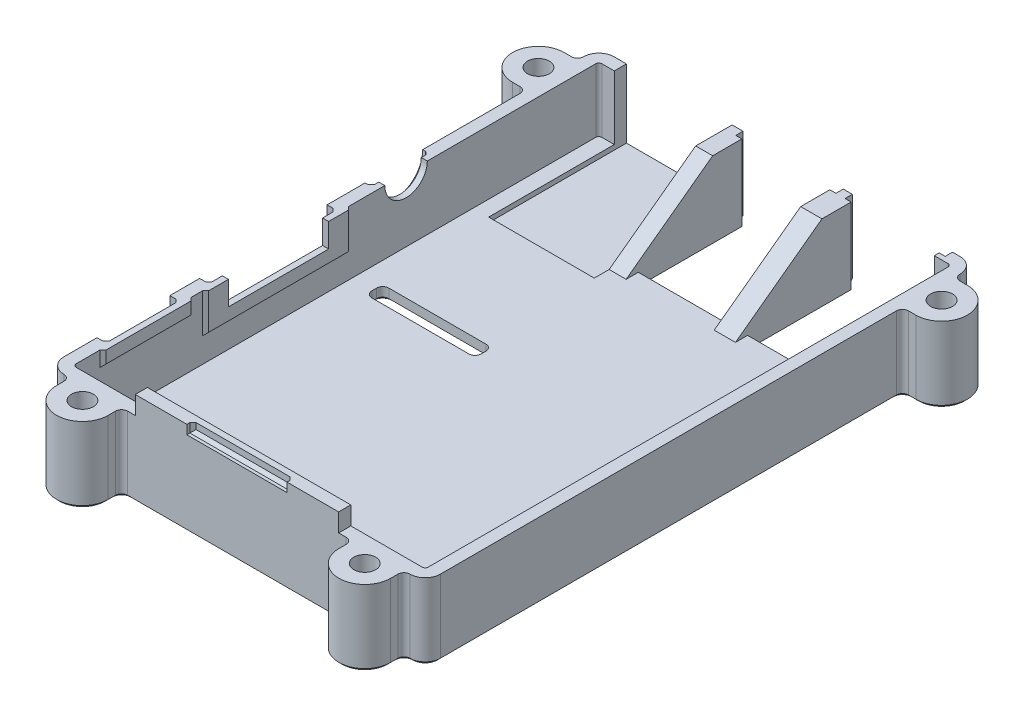
from build123d import *

# Parameters (mm, degrees)
BASE_DEPTH                      = 12.5
SHELL_T                         = -2
CLAMPS_DEPTH                    = 12.5
CLAMP_FILLETS_R                 = 1
SKETCH20_R                      = 1.8
CLAMP_HOLES_DEPTH               = 115.236651299
SKETCH21_R                      = 2.9
CLAMP_COUNTERSINKS_DEPTH        = 3.4
CLAMP_COUNTERSINK_CHAMFERS_SIZE = 0.3
SKETCH22_W                      = 33.5
SKETCH22_H                      = 2
SD_FILL_DEPTH                   = 3
SKETCH23_W                      = 16.5
SKETCH23_H                      = 1.5
SD_APPROACH_DEPTH               = 1
SD_APPROACH_CHAMFER_SIZE        = 0.5
SKETCH24_W                      = 14.5
SKETCH24_H                      = 12.5
USB_CUTOUT_DEPTH                = 18.25
SKETCH25_W                      = 16.5
SKETCH25_H                      = 12.5
USB_APPROACH_DEPTH              = 1.2
USB_INNER_SUPPORT_DEPTH         = 3.5
USB_OUTER_SUPPORT_DEPTH         = 2.8
SKETCH28_W                      = 17.4
SKETCH28_H                      = 11.3
RJ45_CUTOUT_DEPTH               = 22.7
SKETCH29_W                      = 15
SKETCH29_H                      = 2.5
SKETCH29_W_2                    = 24
SKETCH29_H_2                    = 6.43
HDMI_SUPPORT_DEPTH              = 0.5
HDMI_SUPPORT_CHAMFER_SIZE       = 0.5
SKETCH30_W                      = 21
SKETCH30_H                      = 5.93
SKETCH30_W_2                    = 12
SKETCH30_H_2                    = 2
HDMI_APPROACH_DEPTH             = 1.5
SKETCH31_W                      = 16.5
SKETCH31_H                      = 3.93
HDMI_CUTOUT_DEPTH               = 1
HDMI_APPROACH_CHAMFER_SIZE      = 0.5
SKETCH32_R                      = 3.5
AUDIO_CUTOUT_DEPTH              = 2
SKETCH33_R                      = 4.75
AUDIO_APPROACH_DEPTH            = 1
AUDIO_APPROACH_CHAMFER_SIZE     = 0.5
SKETCH34_W                      = 6
SKETCH34_H                      = 52.7
HEADER_CUTOUT_DEPTH             = 2
HEADER_COVER_DEPTH              = 1
RIBBON_SLOTS_DEPTH              = 2
SHELL_CHAMFER_SIZE              = 0.5


with BuildPart() as part:
    # Sketch2 → Base (new body)
    with BuildSketch(Plane(origin=(0, 0, 0), x_dir=(1, 0, 0), z_dir=(0, 1, 0))):
        with BuildLine():
            Line((2.5, 0), (59.5, 0))
            ThreePointArc((59.5, 0), (61.267766953, 0.732233047), (62, 2.5))
            Line((62, 2.5), (62, 88.1))
            ThreePointArc((62, 88.1), (61.267766953, 89.867766953), (59.5, 90.6))
            Line((59.5, 90.6), (2.5, 90.6))
            ThreePointArc((2.5, 90.6), (0.732233047, 89.867766953), (0, 88.1))
            Line((0, 88.1), (0, 2.5))
            ThreePointArc((0, 2.5), (0.732233047, 0.732233047), (2.5, 0))
        make_face()
    extrude(amount=BASE_DEPTH)

    # Shell
    shell_openings = [part.faces().sort_by_distance(p)[0] for p in [
        (31, 12.5, -45.3),
    ]]
    offset(amount=SHELL_T, openings=shell_openings, kind=Kind.INTERSECTION)

    # Sketch14 → Clamps (add)
    with BuildSketch(Plane.XZ):
        with BuildLine():
            Line((-2.2, -78.6), (0, -78.6))
            Line((0, -78.6), (0, -87.1))
            Line((0, -87.1), (-2.2, -87.1))
            ThreePointArc((-2.2, -87.1), (-6.45, -82.85), (-2.2, -78.6))
        make_face()
        with BuildLine():
            Line((3.5, 2.2), (3.5, 0))
            Line((3.5, 0), (12, 0))
            Line((12, 0), (12, 2.2))
            ThreePointArc((12, 2.2), (7.75, 6.45), (3.5, 2.2))
        make_face()
        with BuildLine():
            Line((64.2, -78.6), (62, -78.6))
            Line((62, -78.6), (62, -87.1))
            Line((62, -87.1), (64.2, -87.1))
            ThreePointArc((64.2, -87.1), (68.45, -82.85), (64.2, -78.6))
        make_face()
        with BuildLine():
            Line((50, 0), (50, 2.2))
            ThreePointArc((50, 2.2), (54.25, 6.45), (58.5, 2.2))
            Line((58.5, 2.2), (58.5, 0))
            Line((58.5, 0), (50, 0))
        make_face()
    extrude(amount=-CLAMPS_DEPTH)

    # Clamp Fillets
    clamp_fillets_edges = [part.edges().sort_by_distance(p)[0] for p in [
        (0, 6.25, -87.1),
        (0, 6.25, -78.6),
        (3.5, 6.25, 0),
        (12, 6.25, 0),
        (62, 6.25, -78.6),
        (62, 6.25, -87.1),
        (50, 6.25, 0),
        (58.5, 6.25, 0),
    ]]
    fillet(clamp_fillets_edges, radius=CLAMP_FILLETS_R - 0.0001)  # a hair under: the kernel refuses the full size

    # Sketch20 → Clamp Holes (cut, through all)
    with BuildSketch(Plane.XZ):
        with Locations(Location((7.75, 2.2, 0), (0, 0, 270))):
            Circle(SKETCH20_R)
        with Locations(Location((54.25, 2.2, 0), (0, 0, 270))):
            Circle(SKETCH20_R)
        with Locations(Location((64.2, -82.85, 0), (0, 0, 270))):
            Circle(SKETCH20_R)
        with Locations(Location((-2.2, -82.85, 0), (0, 0, 270))):
            Circle(SKETCH20_R)
    extrude(amount=-CLAMP_HOLES_DEPTH, mode=Mode.SUBTRACT)

    # Sketch21 → Clamp Countersinks (cut)
    with BuildSketch(Plane.XZ):
        with Locations(Location((7.75, 2.2, 0), (0, 0, 270))):
            Circle(SKETCH21_R)
        with Locations(Location((54.25, 2.2, 0), (0, 0, 270))):
            Circle(SKETCH21_R)
        with Locations(Location((64.2, -82.85, 0), (0, 0, 270))):
            Circle(SKETCH21_R)
        with Locations(Location((-2.2, -82.85, 0), (0, 0, 270))):
            Circle(SKETCH21_R)
    extrude(amount=-CLAMP_COUNTERSINKS_DEPTH, mode=Mode.SUBTRACT)

    # Clamp Countersink Chamfers
    clamp_countersink_chamfers_edges = [part.edges().sort_by_distance(p)[0] for p in [
        (-2.2, 0, -79.95),
        (64.2, 0, -79.95),
        (54.25, 0, 5.1),
        (7.75, 0, 5.1),
    ]]
    chamfer(clamp_countersink_chamfers_edges, length=CLAMP_COUNTERSINK_CHAMFERS_SIZE)

    # Sketch22 → SD Fill (add)
    with BuildSketch(Plane(origin=(0, 12.5, 0), x_dir=(1, 0, 0), z_dir=(0, 1, 0))):
        with Locations((31, 1)):
            Rectangle(SKETCH22_W, SKETCH22_H)
    extrude(amount=SD_FILL_DEPTH)

    # Sketch23 → SD Approach (cut)
    with BuildSketch(Plane.XY):
        with Locations((31, 14.75)):
            Rectangle(SKETCH23_W, SKETCH23_H)
    extrude(amount=-SD_APPROACH_DEPTH, mode=Mode.SUBTRACT)

    # SD Approach Chamfer
    sd_approach_chamfer_edges = [part.edges().sort_by_distance(p)[0] for p in [
        (22.75, 14.75, -1),
        (39.25, 14.75, -1),
        (31, 14, -1),
    ]]
    chamfer(sd_approach_chamfer_edges, length=SD_APPROACH_CHAMFER_SIZE)

    # Sketch24 → USB Cutout (cut)
    with BuildSketch(Plane(origin=(0, 0, -90.6), x_dir=(-1, 0, 0), z_dir=(0, 0, -1))):
        with Locations((-50, 6.25)):
            Rectangle(SKETCH24_W, SKETCH24_H)
        with Locations((-32, 6.25)):
            Rectangle(SKETCH24_W, SKETCH24_H)
    extrude(amount=-USB_CUTOUT_DEPTH, mode=Mode.SUBTRACT)

    # Sketch25 → USB Approach (cut)
    with BuildSketch(Plane(origin=(0, 0, -90.6), x_dir=(-1, 0, 0), z_dir=(0, 0, -1))):
        with Locations((-50, 6.25)):
            Rectangle(SKETCH25_W, SKETCH25_H)
        with Locations((-32, 6.25)):
            Rectangle(SKETCH25_W, SKETCH25_H)
    extrude(amount=-USB_APPROACH_DEPTH, mode=Mode.SUBTRACT)

    # Sketch26 → USB Inner Support (add)
    with BuildSketch(Plane(origin=(42.75, 0, 0), x_dir=(0, 0, -1), z_dir=(1, 0, 0))):
        Polygon((88.6, 2), (88.6, 12.5), (84.6, 12.5), (70.35, 2), align=None)
    extrude(amount=-USB_INNER_SUPPORT_DEPTH)

    # Sketch27 → USB Outer Support (add)
    with BuildSketch(Plane(origin=(24.75, 0, 0), x_dir=(0, 0, -1), z_dir=(1, 0, 0))):
        Polygon((88.6, 2), (88.6, 12.5), (84.6, 12.5), (70.35, 2), align=None)
    extrude(amount=-USB_OUTER_SUPPORT_DEPTH)

    # Sketch28 → RJ45 Cutout (cut)
    with BuildSketch(Plane(origin=(0, 0, -90.6), x_dir=(-1, 0, 0), z_dir=(0, 0, -1))):
        with Locations((-13.25, 6.85)):
            Rectangle(SKETCH28_W, SKETCH28_H)
    extrude(amount=-RJ45_CUTOUT_DEPTH, mode=Mode.SUBTRACT)

    # Sketch29 → HDMI Support (add)
    with BuildSketch(Plane(origin=(2, 0, 0), x_dir=(0, 0, -1), z_dir=(1, 0, 0))):
        with Locations((13.95, 11.25)):
            Rectangle(SKETCH29_W, SKETCH29_H)
        with Locations((35.35, 9.285)):
            Rectangle(SKETCH29_W_2, SKETCH29_H_2)
    extrude(amount=HDMI_SUPPORT_DEPTH)

    # HDMI Support Chamfer
    hdmi_support_chamfer_edges = [part.edges().sort_by_distance(p)[0] for p in [
        (2.5, 9.285, -47.35),
        (2.5, 6.07, -35.35),
        (2.5, 9.285, -23.35),
        (2.5, 11.25, -21.45),
        (2.5, 10, -13.95),
        (2.5, 11.25, -6.45),
    ]]
    chamfer(hdmi_support_chamfer_edges, length=HDMI_SUPPORT_CHAMFER_SIZE - 0.0001)  # a hair under: the kernel refuses the full size

    # Sketch30 → HDMI Approach (cut)
    with BuildSketch(Plane.ZY):
        with Locations((-35.35, 9.535)):
            Rectangle(SKETCH30_W, SKETCH30_H)
        with Locations((-13.95, 11.5)):
            Rectangle(SKETCH30_W_2, SKETCH30_H_2)
    extrude(amount=-HDMI_APPROACH_DEPTH, mode=Mode.SUBTRACT)

    # Sketch31 → HDMI Cutout (cut)
    with BuildSketch(Plane.ZY.offset(-1.5)):
        with Locations((-35.35, 10.535)):
            Rectangle(SKETCH31_W, SKETCH31_H)
    extrude(amount=-HDMI_CUTOUT_DEPTH, mode=Mode.SUBTRACT)

    # HDMI Approach Chamfer
    hdmi_approach_chamfer_edges = [part.edges().sort_by_distance(p)[0] for p in [
        (1.5, 9.535, -24.85),
        (1.5, 6.57, -35.35),
        (1.5, 9.535, -45.85),
        (1.5, 11.5, -19.95),
        (1.5, 11.5, -7.95),
        (1.5, 10.5, -13.95),
    ]]
    chamfer(hdmi_approach_chamfer_edges, length=HDMI_APPROACH_CHAMFER_SIZE)

    # Sketch32 → Audio Cutout (cut)
    with BuildSketch(Plane.ZY):
        with Locations((-56.85, 12.5)):
            Circle(SKETCH32_R)
    extrude(amount=-AUDIO_CUTOUT_DEPTH, mode=Mode.SUBTRACT)

    # Sketch33 → Audio Approach (cut)
    with BuildSketch(Plane.ZY):
        with Locations((-56.85, 12.5)):
            Circle(SKETCH33_R)
    extrude(amount=-AUDIO_APPROACH_DEPTH, mode=Mode.SUBTRACT)

    # Audio Approach Chamfer
    audio_approach_chamfer_edges = [part.edges().sort_by_distance(p)[0] for p in [
        (1, 7.75, -56.85),
    ]]
    chamfer(audio_approach_chamfer_edges, length=AUDIO_APPROACH_CHAMFER_SIZE)

    # Sketch34 → Header Cutout (cut)
    with BuildSketch(Plane.XZ):
        with Locations((55.5, -35.75)):
            Rectangle(SKETCH34_W, SKETCH34_H)
    extrude(amount=-HEADER_CUTOUT_DEPTH, mode=Mode.SUBTRACT)

    # Sketch35 → Header Cover (add)
    with BuildSketch(Plane.XZ):
        Polygon((56, -9.4), (55, -9.4), (55, -10.4), (53.5, -10.4), (53.5, -15.3625), (52.5, -15.3625), (52.5, -16.3625), (53.5, -16.3625), (53.5, -28.2875), (52.5, -28.2875), (52.5, -29.2875), (53.5, -29.2875), (53.5, -34.25), (55, -34.25), (55, -35.25), (52.5, -35.25), (52.5, -36.25), (55, -36.25), (55, -37.25), (53.5, -37.25), (53.5, -42.2125), (52.5, -42.2125), (52.5, -43.2125), (53.5, -43.2125), (53.5, -55.1375), (52.5, -55.1375), (52.5, -56.1375), (53.5, -56.1375), (53.5, -61.1), (55, -61.1), (55, -62.1), (56, -62.1), (56, -61.1), (57.5, -61.1), (57.5, -56.1375), (58.5, -56.1375), (58.5, -55.1375), (57.5, -55.1375), (57.5, -43.2125), (58.5, -43.2125), (58.5, -42.2125), (57.5, -42.2125), (57.5, -37.25), (56, -37.25), (56, -36.25), (58.5, -36.25), (58.5, -35.25), (56, -35.25), (56, -34.25), (57.5, -34.25), (57.5, -29.2875), (58.5, -29.2875), (58.5, -28.2875), (57.5, -28.2875), (57.5, -16.3625), (58.5, -16.3625), (58.5, -15.3625), (57.5, -15.3625), (57.5, -10.4), (56, -10.4), align=None)
    extrude(amount=-HEADER_COVER_DEPTH)

    # Sketch36 → Ribbon Slots (cut)
    with BuildSketch(Plane.XZ):
        with BuildLine():
            Line((23.1, -5.7), (39.1, -5.7))
            ThreePointArc((39.1, -5.7), (39.807106781, -5.992893219), (40.1, -6.7))
            Line((40.1, -6.7), (40.1, -7.5))
            ThreePointArc((40.1, -7.5), (39.807106781, -8.207106781), (39.1, -8.5))
            Line((39.1, -8.5), (23.1, -8.5))
            ThreePointArc((23.1, -8.5), (22.392893219, -8.207106781), (22.1, -7.5))
            Line((22.1, -7.5), (22.1, -6.7))
            ThreePointArc((22.1, -6.7), (22.392893219, -5.992893219), (23.1, -5.7))
        make_face()
        with BuildLine():
            Line((6.45, -46.76), (22.45, -46.76))
            ThreePointArc((22.45, -46.76), (23.157106781, -47.052893219), (23.45, -47.76))
            Line((23.45, -47.76), (23.45, -48.56))
            ThreePointArc((23.45, -48.56), (23.157106781, -49.267106781), (22.45, -49.56))
            Line((22.45, -49.56), (6.45, -49.56))
            ThreePointArc((6.45, -49.56), (5.742893219, -49.267106781), (5.45, -48.56))
            Line((5.45, -48.56), (5.45, -47.76))
            ThreePointArc((5.45, -47.76), (5.742893219, -47.052893219), (6.45, -46.76))
        make_face()
    extrude(amount=-RIBBON_SLOTS_DEPTH, mode=Mode.SUBTRACT)

    # Shell Chamfer
    shell_chamfer_edges = [part.edges().sort_by_distance(p)[0] for p in [
        (-1.59995, 0, -78.6),
        (63.59995, 0, -87.1),
        (49.707136071, 0, 0.292863929),
        (0.732233047, 0, -0.732233047),
        (58.792863929, 0, 0.292863929),
        (12.292863929, 0, 0.292863929),
        (3.207136071, 0, 0.292863929),
        (-0.292863929, 0, -87.392863929),
        (-0.292863929, 0, -78.307136071),
        (62.292863929, 0, -78.307136071),
        (62.292863929, 0, -87.392863929),
        (13.125, 0, -90.6),
        (41, 0, -90.6),
        (-6.45, 0, -82.85),
        (-1.59995, 0, -87.1),
        (7.75, 0, 6.45),
        (3.5, 0, 1.59995),
        (52.5, 0, -12.38125),
        (53.75, 0, -62.1),
        (58.5, 0, -59.11875),
        (57.25, 0, -9.4),
        (57.25, 0, -62.1),
        (58.5, 0, -49.175),
        (58.5, 0, -39.23125),
        (58.5, 0, -32.26875),
        (58.5, 0, -22.325),
        (58.5, 0, -12.38125),
        (53.75, 0, -9.4),
        (52.5, 0, -22.325),
        (52.5, 0, -32.26875),
        (52.5, 0, -39.23125),
        (52.5, 0, -49.175),
        (52.5, 0, -59.11875),
        (68.45, 0, -82.85),
        (63.59995, 0, -78.6),
        (22.392893219, 0, -8.207106781),
        (31.1, 0, -8.5),
        (39.807106781, 0, -8.207106781),
        (40.1, 0, -7.1),
        (39.807106781, 0, -5.992893219),
        (31.1, 0, -5.7),
        (22.392893219, 0, -5.992893219),
        (22.1, 0, -7.1),
        (54.25, 0, 6.45),
        (50, 0, 1.59995),
        (5.742893219, 0, -49.267106781),
        (14.45, 0, -49.56),
        (23.157106781, 0, -49.267106781),
        (23.45, 0, -48.16),
        (23.157106781, 0, -47.052893219),
        (14.45, 0, -46.76),
        (5.742893219, 0, -47.052893219),
        (5.45, 0, -48.16),
        (0.732233047, 0, -89.867766953),
        (58.875, 0, -90.6),
        (61.267766953, 0, -89.867766953),
        (31, 0, 0),
        (62, 0, -40.05005),
        (58.5, 0, 1.59995),
        (12, 0, 1.59995),
        (61.267766953, 0, -0.732233047),
        (0, 0, -40.05005),
    ]]
    chamfer(shell_chamfer_edges, length=SHELL_CHAMFER_SIZE)


solid = part.part
